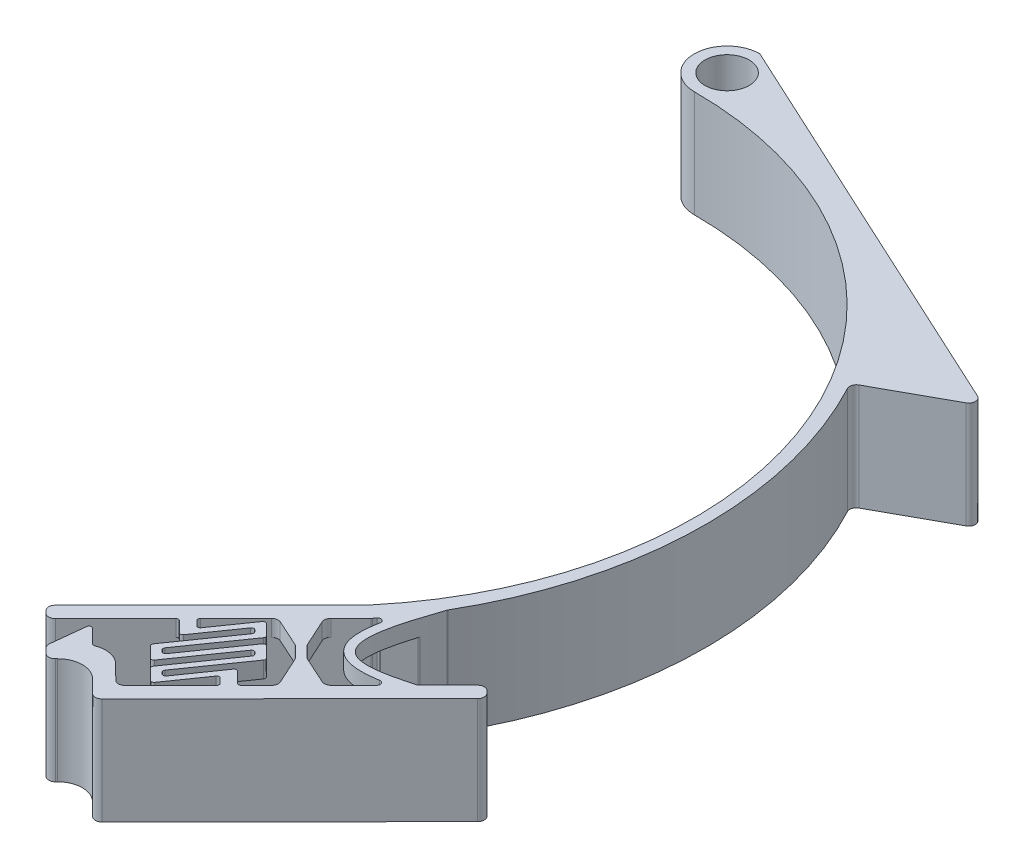
from build123d import *

# Parameters (mm, degrees)
BOSS_EXTRUDE1_DEPTH = 13
SKETCH2_W           = 10
SKETCH2_H           = 9
CUT_EXTRUDE1_DEPTH  = 90.94927337853629
FILLET2_R           = 0.8
FILLET4_R           = 3
FILLET5_R           = 3
FILLET6_R           = 0.3
CUT_EXTRUDE2_DEPTH  = 77.54524197835505
FILLET7_R           = 0.3
FILLET8_START       = 2
FILLET8_DEPTH       = 9
FILLET8_2_DEPTH     = 13
FILLET8_3_DEPTH     = 2
FILLET8_START_2     = 11
FILLET8_4_DEPTH     = 2


with BuildPart() as part:
    # Sketch1 → Boss-Extrude1 (new body)
    # profile 1 of 12: a face of its own
    with BuildSketch(Plane(origin=(0, 0, 0), x_dir=(1, 0, 0), z_dir=(0, 1, 0))):
        with BuildLine():
            Line((50.820681644035226, 29.47855622552854), (0, 52.99999999999999))
            Line((0, 52.99999999999999), (0, 51.69999999999999))
            ThreePointArc((2.115e-14, 51.69999999999999), (1.909188309203686, 50.90918830920366), (2.7, 48.999999999999986))
            ThreePointArc((2.7, 48.999999999999986), (2.697737837088877, 48.88949858671026), (2.690955139008128, 48.77918233801221))
            ThreePointArc((2.6909551390081177, 48.77918233801222), (24.5636877391301, 40.824426362915915), (40.31112943915423, 23.686379393552382))
            Line((40.31112943915425, 23.68637939355239), (50.820681644035226, 29.47855622552854))
        make_face()
    # profile 2 of 12: a face of its own
    with BuildSketch(Plane(origin=(0, 0, 0), x_dir=(1, 0, 0), z_dir=(0, 1, 0))):
        with BuildLine():
            Line((0, 51.69999999999999), (0, 52.99999999999999))
            ThreePointArc((-9.3e-16, 52.999999999999986), (-4.000000000000001, 48.999999999999986), (0, 44.999999999999986))
            ThreePointArc((0, 44.99999999999999), (40.783850416649216, 19.017821778331506), (34.47199994035405, -28.925442435894198))
            Line((34.47199994035406, -28.9254424358942), (35.88826060340199, -30.337605930077153))
            Line((35.88826060340199, -30.337605930077153), (36.00408882659202, -30.211017655267266))
            ThreePointArc((36.00408882659201, -30.21101765526727), (36.73959953762062, -29.245162805319858), (37.45099234946866, -28.261408839912))
            ThreePointArc((37.45099234946866, -28.261408839912), (38.605430842390376, -26.547098918310425), (39.686660018552246, -24.78569884738466))
            ThreePointArc((39.686660018552246, -24.78569884738466), (46.40205656648786, -0.6321521412684419), (40.31112943915423, 23.686379393552382))
            ThreePointArc((40.31112943915423, 23.686379393552382), (24.5636877391301, 40.824426362915915), (2.6909551390081177, 48.77918233801222))
            ThreePointArc((2.690955139008128, 48.77918233801221), (-1.9857250171369463, 47.170547580198786), (2.055e-14, 51.69999999999999))
        make_face()
    # profile 3 of 12: a face of its own
    with BuildSketch(Plane(origin=(0, 0, 0), x_dir=(1, 0, 0), z_dir=(0, 1, 0))):
        Polygon((35.88826060340199, -30.337605930077153), (34.47199994035406, -28.9254424358942), (20.350364998523673, -43.08804906637437), (21.766625661572196, -44.50021256055665), (24.23791177639238, -42.02175640022277), (25.2970343970296, -40.959560902936815), (30.239606626669783, -36.00264858226924), (33.06393361503564, -33.170127256173444), align=None)
    # profile 4 of 12: a face of its own
    with BuildSketch(Plane(origin=(0, 0, 0), x_dir=(1, 0, 0), z_dir=(0, 1, 0))):
        with BuildLine():
            add(Edge.make_bspline(
                [(45.83591790353825, -34.5237531436869), (41.843450702633426, -35.71508333997702), (36.3511197150314, -36.07951954087839), (38.00191353171288, -29.656533685626375), (39.686660018552246, -24.785698847384662)],
                knots=[0, 0, 0, 0, 0.4214238579169782, 1, 1, 1, 1], degree=3))
            ThreePointArc((39.686660018552246, -24.78569884738466), (38.605430842390376, -26.547098918310425), (37.45099234946866, -28.261408839912))
            add(Edge.make_bspline(
                [(44.28219117655379, -36.081987762850076), (34.30088789751079, -38.47611959656704), (37.45099234946867, -28.26140883991201)],
                knots=[0, 0, 0, 1, 1, 1], degree=2))
            Line((44.28219117655378, -36.08198776285007), (45.83591790353825, -34.5237531436869))
        make_face()
    # profile 5 of 12: a face of its own
    with BuildSketch(Plane(origin=(0, 0, 0), x_dir=(1, 0, 0), z_dir=(0, 1, 0))):
        Polygon((21.766625661572196, -44.50021256055665), (20.350364998523673, -43.08804906637437), (14.701711021791766, -48.75309171856604), (16.117971684839706, -50.16525521274901), align=None)
    # profile 6 of 12: a face of its own
    with BuildSketch(Plane(origin=(0, 0, 0), x_dir=(1, 0, 0), z_dir=(0, 1, 0))):
        Polygon((50.03038138955628, -30.317120085752492), (45.83591790353825, -34.5237531436869), (44.28219117655378, -36.08198776285007), (40.14523693027535, -40.230944727088186), (37.32090994190943, -43.063466053184044), (34.84962382708942, -45.54192221351774), (33.790501206452205, -46.604117710803685), (28.847928976811804, -51.56103003147147), (30.264189639859772, -52.97319352565442), (51.44664205260421, -31.72928357993546), align=None)
    # profile 7 of 12: a face of its own
    with BuildSketch(Plane(origin=(0, 0, 0), x_dir=(1, 0, 0), z_dir=(0, 1, 0))):
        Polygon((34.837332320494355, -37.056649741825254), (33.06393361503566, -33.170127256173465), (30.239606626669783, -36.00264858226924), (34.13125057340287, -37.76478007334922), (35.54751123645081, -39.17694356753218), (37.32090994190944, -43.06346605318406), (40.14523693027535, -40.230944727088186), (36.25359298354228, -38.46881323600821), align=None)
    # profile 8 of 12: a face of its own
    with BuildSketch(Plane(origin=(0, 0, 0), x_dir=(1, 0, 0), z_dir=(0, 1, 0))):
        Polygon((25.2970343970296, -40.959560902936815), (24.23791177639238, -42.02175640022277), (25.45763253379472, -43.23794856854431), (26.32946142947339, -41.989001177361374), align=None)
    # profile 9 of 12: a face of its own
    with BuildSketch(Plane(origin=(0, 0, 0), x_dir=(1, 0, 0), z_dir=(0, 1, 0))):
        Polygon((26.32946142947339, -41.989001177361374), (25.457632533794715, -43.23794856854431), (24.585803638116044, -44.48689595972725), (24.00458437433026, -45.319527553849206), (29.270758591293745, -50.5704670011109), (32.75807417400843, -45.57467743637915), (33.629903069687096, -44.32573004519622), (34.50173196536579, -43.07678265401324), (35.08295122915156, -42.24415105989131), (29.81677701218808, -36.99321161262962), align=None)
        Polygon((32.77765265760335, -41.35769101853796), (28.127898547317077, -48.01874377151366), (27.490581248945503, -47.383270199131324), (32.14033535923178, -40.72221744615563), align=None, mode=Mode.SUBTRACT)
        Polygon((31.596954354536333, -40.18040841460916), (26.947200244250066, -46.84146116758485), (26.309882945878492, -46.20598759520252), (30.959637056164766, -39.54493484222682), align=None, mode=Mode.SUBTRACT)
        Polygon((33.95835096067035, -42.534973622466765), (29.308596850384085, -49.196026375442464), (28.671279552012514, -48.56055280306014), (33.32103366229879, -41.899500050084434), align=None, mode=Mode.SUBTRACT)
        Polygon((30.416256051469322, -39.00312581068036), (25.76650194118305, -45.66417856365605), (25.129184642811488, -45.02870499127372), (29.778938753097755, -38.36765223829802), align=None, mode=Mode.SUBTRACT)
    # profile 10 of 12: a face of its own
    with BuildSketch(Plane(origin=(0, 0, 0), x_dir=(1, 0, 0), z_dir=(0, 1, 0))):
        Polygon((27.439862651493854, -55.80571485175028), (30.264189639859772, -52.97319352565442), (28.847928976811804, -51.56103003147147), (27.435765482628845, -52.9772906945194), (23.186983493485094, -48.7408002119705), (21.774819999301485, -50.15706087501908), (18.950493010935563, -52.989582201114935), (20.366753673983496, -54.4017456952979), (23.191080662350057, -51.56922436920139), align=None)
    # profile 11 of 12: a face of its own
    with BuildSketch(Plane(origin=(0, 0, 0), x_dir=(1, 0, 0), z_dir=(0, 1, 0))):
        Polygon((33.790501206452205, -46.604117710803685), (34.84962382708942, -45.54192221351774), (33.629903069687096, -44.32573004519622), (32.75807417400843, -45.57467743637915), align=None)
    # profile 12 of 12: a face of its own
    with BuildSketch(Plane(origin=(0, 0, 0), x_dir=(1, 0, 0), z_dir=(0, 1, 0))):
        Polygon((18.950493010935563, -52.989582201114935), (21.774819999301485, -50.15706087501908), (19.508802938424797, -47.89759928432634), align=None)
    extrude(amount=BOSS_EXTRUDE1_DEPTH)

    # Sketch2 → Cut-Extrude1 (cut, through all)
    with BuildSketch(Plane(origin=(-10.692148728522676, 0, 10.72317030573422), x_dir=(0.7081303315239577, 0, 0.7060817470914894), z_dir=(-0.7060817470914894, 0, 0.7081303315239577))):
        with Locations((51.834395676587306, 6.5)):
            Rectangle(SKETCH2_W, SKETCH2_H)
    extrude(amount=-CUT_EXTRUDE1_DEPTH, mode=Mode.SUBTRACT)

    # Fillet2
    fillet2_edges = [part.edges().sort_by_distance(p)[0] for p in [
        (40.311129439154236, 6.5, -23.68637939355239),
        (50.820681644035226, 6.5, -29.47855622552854),
        (40.14523693027536, 12, 40.23094472708819),
        (36.25359298354228, 12, 38.46881323600821),
        (34.837332320494355, 12, 37.056649741825254),
        (33.06393361503565, 12, 33.17012725617346),
        (30.239606626669786, 1, 36.00264858226924),
        (37.320909941909434, 1, 43.06346605318405),
        (40.14523693027536, 1, 40.23094472708819),
        (33.06393361503565, 1, 33.17012725617346),
        (34.837332320494355, 1, 37.056649741825254),
        (36.25359298354228, 1, 38.46881323600821),
        (14.701711021791766, 6.5, 48.75309171856604),
        (16.117971684839706, 6.5, 50.16525521274901),
        (30.239606626669786, 12, 36.00264858226924),
        (34.13125057340287, 12, 37.76478007334922),
        (35.54751123645081, 12, 39.17694356753218),
        (37.320909941909434, 12, 43.06346605318405),
        (27.435765482628845, 6.5, 52.9772906945194),
        (18.950493010935563, 6.5, 52.989582201114935),
        (20.366753673983496, 6.5, 54.4017456952979),
        (27.439862651493854, 6.5, 55.80571485175028),
        (51.44664205260421, 6.5, 31.72928357993546),
        (50.03038138955628, 6.5, 30.317120085752492),
    ]]
    fillet(fillet2_edges, radius=FILLET2_R)

    # Fillet4
    fillet4_edges = [part.edges().sort_by_distance(p)[0] for p in [
        (23.191080662350057, 6.5, 51.56922436920139),
    ]]
    fillet(fillet4_edges, radius=FILLET4_R)

    # Fillet5
    # the kernel refuses this fillet: 3 mm, written as the material it takes off along each edge
    with BuildSketch(Plane(origin=(23.186983493485094, -7.071067811866335, 48.7408002119705), x_dir=(-0.7060817470914805, 0, 0.7081303315239663), z_dir=(0, 1, 0))) as fillet5_piece_1:
        with BuildLine():
            CenterArc((3.0000000000000164, 2.8284271247465114), FILLET5_R, 179.99999999999957, 70.52877936552801)
            Line((1.621e-14, 2.828427124746535), (-0.05999999999998207, 2.8284271247465385))
            Line((-0.05999999999998207, 2.8284271247465385), (-0.05999999999999828, 3.58e-15))
            Line((-0.05999999999999828, 3.58e-15), (-1.07e-15, -0.0600000000000008))
            ThreePointArc((-1.07e-15, -0.0600000000000008), (1.0000000000004678, -0.06000000000000588), (1.9800000000009357, -0.0565685424949286))
            Line((1.9800000000009357, -0.0565685424949286), (2.0000000000009175, -1.1e-16))
        make_face()
    extrude(amount=27.14213562373267, mode=Mode.SUBTRACT)

    # Fillet6
    fillet6_edges = [part.edges().sort_by_distance(p)[0] for p in [
        (21.774819999301485, 6.5, 50.157060875019084),
        (19.508802938424797, 6.5, 47.89759928432634),
    ]]
    fillet(fillet6_edges, radius=FILLET6_R)

    # Sketch3 → Cut-Extrude2 (cut, through all)
    with BuildSketch(Plane(origin=(0, 13, 0), x_dir=(1, 0, 0), z_dir=(0, 1, 0))):
        Polygon((25.185282677397268, -46.49681015777802), (26.638330836861723, -44.41523117247312), (25.45763253379464, -43.23794856854434), (24.004584374330186, -45.31952755384924), align=None)
        Polygon((26.909361985159645, -48.21590179325333), (27.546679283531212, -48.85137536563566), (28.127898547316995, -48.018743771513705), (27.49058124894543, -47.38327019913137), align=None)
        Polygon((33.90225292608447, -41.06686845596254), (32.449204766620014, -43.14844744126745), (33.629903069687025, -44.32573004519626), (35.08295122915149, -42.24415105989136), align=None)
        Polygon((32.17817361832203, -39.347776820487276), (31.540856319950453, -38.712303248104945), (30.959637056164688, -39.544934842226866), (31.596954354536265, -40.18040841460921), align=None)
    extrude(amount=-CUT_EXTRUDE2_DEPTH, mode=Mode.SUBTRACT)

    # Fillet7
    fillet7_edges = [part.edges().sort_by_distance(p)[0] for p in [
        (25.2970343970296, 1, 40.959560902936815),
        (26.32946142947339, 1, 41.989001177361374),
        (24.23791177639238, 1, 42.02175640022277),
        (33.790501206452205, 1, 46.60411771080369),
        (32.75807417400843, 12, 45.57467743637915),
        (34.849623827089424, 1, 45.54192221351775),
        (30.416256051469322, 1, 39.00312581068036),
        (29.778938753097755, 1, 38.36765223829802),
        (26.309882945878492, 1, 46.20598759520252),
        (26.947200244250066, 1, 46.84146116758485),
        (32.77765265760335, 1, 41.35769101853796),
        (32.14033535923178, 1, 40.72221744615563),
        (28.671279552012514, 1, 48.56055280306014),
        (29.308596850384085, 1, 49.196026375442464),
        (29.270758591293745, 1, 50.5704670011109),
        (29.81677701218808, 1, 36.99321161262962),
        (29.270758591293745, 12, 50.5704670011109),
        (29.81677701218808, 12, 36.99321161262962),
        (29.308596850384085, 12, 49.196026375442464),
        (28.671279552012514, 12, 48.56055280306014),
        (32.14033535923178, 12, 40.72221744615563),
        (32.77765265760335, 12, 41.35769101853796),
        (26.309882945878492, 12, 46.20598759520252),
        (26.947200244250066, 12, 46.84146116758485),
        (29.778938753097755, 12, 38.36765223829802),
        (30.416256051469322, 12, 39.00312581068036),
        (25.185282677397268, 12, 46.49681015777802),
        (25.185282677397268, 1, 46.49681015777802),
        (26.00101353849013, 12, 43.77975760009082),
        (26.00101353849013, 1, 43.77975760009082),
        (26.32946142947339, 12, 41.989001177361374),
        (27.546679283531212, 12, 48.85137536563566),
        (27.546679283531212, 1, 48.85137536563566),
        (26.909361985159645, 12, 48.21590179325333),
        (26.909361985159645, 1, 48.21590179325333),
        (32.75807417400843, 1, 45.57467743637915),
        (33.90225292608447, 12, 41.06686845596254),
        (33.90225292608447, 1, 41.06686845596254),
        (33.086522064991605, 12, 43.78392101364981),
        (33.086522064991605, 1, 43.78392101364981),
        (31.540856319950453, 12, 38.712303248104945),
        (31.540856319950453, 1, 38.712303248104945),
        (32.17817361832203, 12, 39.347776820487276),
        (32.17817361832203, 1, 39.347776820487276),
        (25.2970343970296, 12, 40.959560902936815),
        (24.23791177639238, 12, 42.02175640022277),
        (33.790501206452205, 12, 46.60411771080369),
        (34.849623827089424, 12, 45.54192221351775),
    ]]
    fillet(fillet7_edges, radius=FILLET7_R)

    # Fillet8: read off the stored shape, not the designer's step
    # Fillet8 outline → Fillet8 (cut)
    with BuildSketch(Plane(origin=(0, 0, 0), x_dir=(1, 0, 0), z_dir=(0, 1, 0)).offset(FILLET8_START)):
        with BuildLine():
            ThreePointArc((38.858596252, -27.293685395), (38.819143393, -27.381738166), (38.759753437, -27.457781915))
            Line((38.759753437, -27.457781915), (38.829545298, -27.387787552))
            add(Edge.make_bspline(
                [(38.829545298, -27.387787552), (38.83917652921099, -27.356489010799876), (38.84886037952777, -27.325121490924264), (38.858596252, -27.293685395)],
                knots=[0.8918944366474967, 0.8918944366474967, 0.8918944366474967, 0.8918944366474967, 0.8960097108625565, 0.8960097108625565, 0.8960097108625565, 0.8960097108625565], degree=3))
        make_face()
    extrude(amount=FILLET8_DEPTH, mode=Mode.SUBTRACT)

    # Fillet8 2 outline → Fillet8 2 (add)
    with BuildSketch(Plane(origin=(0, 0, 0), x_dir=(1, 0, 0), z_dir=(0, 1, 0))):
        with BuildLine():
            add(Edge.make_bspline(
                [(39.673775255, -24.822969197), (39.67806540547455, -24.810553280265527), (39.682360335828115, -24.798129824133703), (39.686660019, -24.785698847)],
                knots=[0.9985234016737146, 0.9985234016737146, 0.9985234016737146, 0.9985234016737146, 1, 1, 1, 1], degree=3))
            ThreePointArc((39.673775255, -24.822969197), (39.688369986, -24.786607181), (39.706452235, -24.75184751))
            ThreePointArc((39.706452235, -24.75184751), (39.696559508, -24.768775156), (39.686660019, -24.785698847))
        make_face()
        with BuildLine():
            Line((36.448547027, -29.775693924), (37.24112326, -28.980818152))
            add(Edge.make_bspline(
                [(37.24112326, -28.980818152), (37.337541599544764, -28.629290798517612), (37.450992349, -28.26140884)],
                knots=[0.9639850831443336, 0.9639850831443336, 0.9639850831443336, 1, 1, 1], degree=2))
            ThreePointArc((37.450992349, -28.26140884), (36.849243023, -29.096843669), (36.230098864, -29.919470021))
            ThreePointArc((36.230098864, -29.919470021), (36.327241089, -29.82922524), (36.448547027, -29.775693924))
        make_face()
    extrude(amount=FILLET8_2_DEPTH)

    # Fillet8 3 outline → Fillet8 3 (add)
    with BuildSketch(Plane(origin=(0, 0, 0), x_dir=(1, 0, 0), z_dir=(0, 1, 0))):
        with BuildLine():
            add(Edge.make_bspline(
                [(36.939314187, -30.242145596), (37.060249244889945, -29.64025871580916), (37.24112326, -28.980818152)],
                knots=[0.8964236350366135, 0.8964236350366135, 0.8964236350366135, 0.9639850831443336, 0.9639850831443336, 0.9639850831443336], degree=2))
            Line((37.24112326, -28.980818152), (36.448547027, -29.775693924))
            ThreePointArc((36.448547027, -29.775693924), (36.822720933, -29.87341577), (36.939314187, -30.242145596))
        make_face()
        with BuildLine():
            ThreePointArc((45.907715931, -34.451746806), (45.829222834, -34.512932699), (45.738054027, -34.552846713))
            add(Edge.make_bspline(
                [(45.835917904, -34.523753144), (45.803183895881524, -34.533520791060006), (45.77056267895474, -34.54321867825405), (45.738054027, -34.552846713)],
                knots=[0, 0, 0, 0, 0.00345522983599662, 0.00345522983599662, 0.00345522983599662, 0.00345522983599662], degree=3))
            Line((45.835917904, -34.523753144), (45.907715931, -34.451746806))
        make_face()
        with BuildLine():
            add(Edge.make_bspline(
                [(44.282191177, -36.081987763), (43.60694223249883, -36.24395408602956), (42.991791924, -36.348213403)],
                knots=[0, 0, 0, 0.06765138030348591, 0.06765138030348591, 0.06765138030348591], degree=2))
            ThreePointArc((42.991791924, -36.348213403), (43.413915857, -36.558811773), (43.3418852, -37.025021889))
            Line((43.3418852, -37.025021889), (44.282191177, -36.081987763))
        make_face()
    extrude(amount=FILLET8_3_DEPTH)

    # Fillet8 4 outline → Fillet8 4 (add)
    with BuildSketch(Plane(origin=(0, 0, 0), x_dir=(1, 0, 0), z_dir=(0, 1, 0)).offset(FILLET8_START_2)):
        with BuildLine():
            add(Edge.make_bspline(
                [(36.939314187, -30.242145596), (37.060249244889945, -29.64025871580916), (37.24112326, -28.980818152)],
                knots=[0.8964236350366135, 0.8964236350366135, 0.8964236350366135, 0.9639850831443336, 0.9639850831443336, 0.9639850831443336], degree=2))
            Line((37.24112326, -28.980818152), (36.448547027, -29.775693924))
            ThreePointArc((36.448547027, -29.775693924), (36.822720933, -29.87341577), (36.939314187, -30.242145596))
        make_face()
        with BuildLine():
            ThreePointArc((45.907715931, -34.451746806), (45.829222834, -34.512932699), (45.738054027, -34.552846713))
            add(Edge.make_bspline(
                [(45.835917904, -34.523753144), (45.803183895881524, -34.533520791060006), (45.77056267895474, -34.54321867825405), (45.738054027, -34.552846713)],
                knots=[0, 0, 0, 0, 0.00345522983599662, 0.00345522983599662, 0.00345522983599662, 0.00345522983599662], degree=3))
            Line((45.835917904, -34.523753144), (45.907715931, -34.451746806))
        make_face()
        with BuildLine():
            add(Edge.make_bspline(
                [(44.282191177, -36.081987763), (43.60694223249883, -36.24395408602956), (42.991791924, -36.348213403)],
                knots=[0, 0, 0, 0.06765138030348591, 0.06765138030348591, 0.06765138030348591], degree=2))
            ThreePointArc((42.991791924, -36.348213403), (43.413915857, -36.558811773), (43.3418852, -37.025021889))
            Line((43.3418852, -37.025021889), (44.282191177, -36.081987763))
        make_face()
    extrude(amount=FILLET8_4_DEPTH)


solid = part.part
